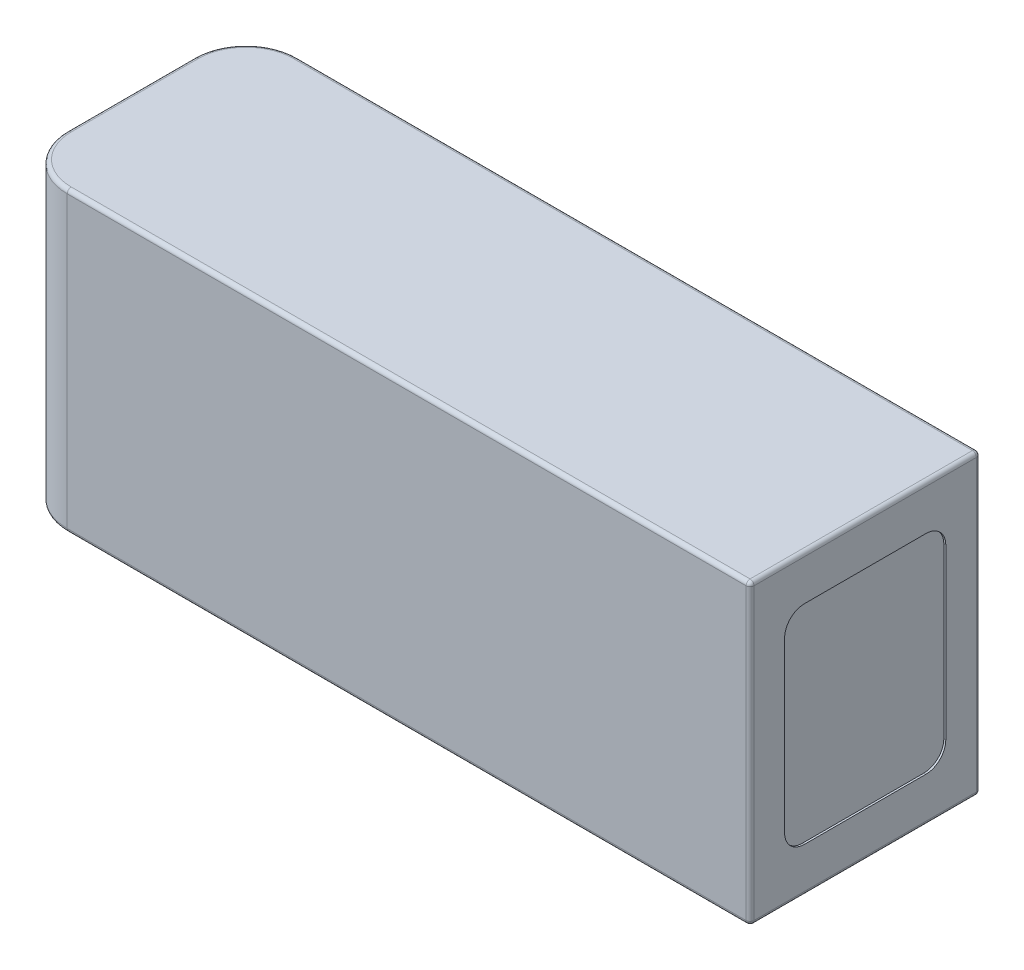
from build123d import *

# Parameters (mm, degrees)
SKETCH1_W           = 185
SKETCH1_H           = 75
BOSS_EXTRUDE1_DEPTH = 58
CUT_EXTRUDE1_DEPTH  = 0.5
CUT_EXTRUDE2_DEPTH  = 0.5
FILLET1_R           = 13
FILLET2_R           = 1


with BuildPart() as part:
    # Sketch1 → Boss-Extrude1 (new body)
    with BuildSketch(Plane(origin=(0, 0, -15), x_dir=(-1, 0, 0), z_dir=(0, 0, -1))):
        with Locations((23.5, 15.5)):
            Rectangle(SKETCH1_W, SKETCH1_H)
    extrude(amount=-BOSS_EXTRUDE1_DEPTH)

    # Sketch2 → Cut-Extrude1 (cut)
    with BuildSketch(Plane(origin=(69, 0, 0), x_dir=(0, 0, -1), z_dir=(1, 0, 0))):
        with BuildLine():
            Line((-34.3, 36.75), (-34.3, -5.75))
            ThreePointArc((-34.3, -5.75), (-32.835533906, -9.285533906), (-29.3, -10.75))
            Line((-29.3, -10.75), (1.3, -10.75))
            ThreePointArc((1.3, -10.75), (4.835533906, -9.285533906), (6.3, -5.75))
            Line((6.3, -5.75), (6.3, 36.75))
            ThreePointArc((6.3, 36.75), (4.835533906, 40.285533906), (1.3, 41.75))
            Line((1.3, 41.75), (-29.3, 41.75))
            ThreePointArc((-29.3, 41.75), (-32.835533906, 40.285533906), (-34.3, 36.75))
        make_face()
    extrude(amount=-CUT_EXTRUDE1_DEPTH, mode=Mode.SUBTRACT)

    # Sketch3 → Cut-Extrude2 (cut)
    with BuildSketch(Plane.ZY.offset(116)):
        with BuildLine():
            Line((27.75, 43.625), (0.25, 43.625))
            ThreePointArc((0.25, 43.625), (-5.406854249, 41.281854249), (-7.75, 35.625))
            Line((-7.75, 35.625), (-7.75, -4.625))
            ThreePointArc((-7.75, -4.625), (-5.406854249, -10.281854249), (0.25, -12.625))
            Line((0.25, -12.625), (27.75, -12.625))
            ThreePointArc((27.75, -12.625), (33.406854249, -10.281854249), (35.75, -4.625))
            Line((35.75, -4.625), (35.75, 35.625))
            ThreePointArc((35.75, 35.625), (33.406854249, 41.281854249), (27.75, 43.625))
        make_face()
    extrude(amount=-CUT_EXTRUDE2_DEPTH, mode=Mode.SUBTRACT)

    # Fillet1
    # the kernel refuses this fillet: 13 mm, written as the material it takes off along each edge
    with BuildSketch(Plane(origin=(-116, -54.5, -15), x_dir=(0, 0, 1), z_dir=(0, 1, 0))) as fillet1_piece_1:
        with BuildLine():
            CenterArc((FILLET1_R, FILLET1_R), FILLET1_R, 180, 90)
            Line((0, FILLET1_R), (0, 0))
            Line((0, 0), (FILLET1_R, 0))
        make_face()
    extrude(amount=140, mode=Mode.SUBTRACT)
    with BuildSketch(Plane(origin=(-116, -54.5, 43), x_dir=(0, 0, -1), z_dir=(0, 1, 0))) as fillet1_piece_2:
        with BuildLine():
            CenterArc((FILLET1_R, -FILLET1_R), FILLET1_R, 90, 90)
            Line((0, -FILLET1_R), (0, 0))
            Line((0, 0), (FILLET1_R, 0))
        make_face()
    extrude(amount=140, mode=Mode.SUBTRACT)

    # Fillet2
    fillet2_edges = [part.edges().sort_by_distance(p)[0] for p in [
        (69, 15.5, 43),
        (-17, -22, -15),
        (69, 15.5, -15),
        (-17, 53, -15),
        (-116, 53, 14),
        (-17, 53, 43),
        (-112.192388155, 53, 39.192388155),
        (-112.192388155, 53, -11.192388155),
        (-116, -22, 14),
        (-17, -22, 43),
        (-112.192388155, -22, 39.192388155),
        (69, 53, 14),
        (-112.192388155, -22, -11.192388155),
        (69, -22, 14),
    ]]
    fillet(fillet2_edges, radius=FILLET2_R)


solid = part.part
